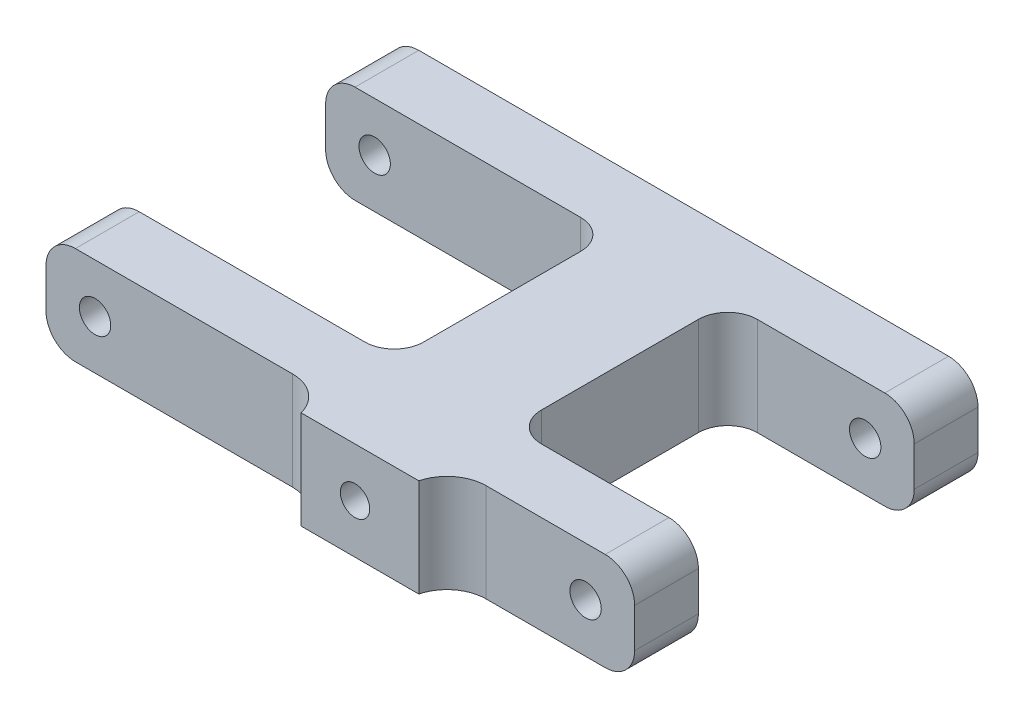
from build123d import *

# Parameters (mm, degrees)
SKETCH1_W               = 60
SKETCH1_H               = 35
BOSS_EXTRUDE1_DEPTH     = 10
SKETCH2_W               = 22
SKETCH2_H               = 10
CUT_EXTRUDE1_DEPTH      = 19
SKETCH3_W               = 22
SKETCH3_H               = 10
CUT_EXTRUDE2_DEPTH      = 29
SKETCH5_R               = 1.6
CUT_EXTRUDE4_DEPTH      = 71.178344238
FILLET1_R               = 3
FILLET2_R               = 3
SKETCH7_W               = 12
SKETCH7_H               = 10
BOSS_EXTRUDE2_DEPTH     = 3
CUT_EXTRUDE5_DEPTH      = 3
CUT_EXTRUDE5_DEPTH_BACK = 15
SKETCH6_R               = 1.5
FILLET3_R               = 4


with BuildPart() as part:
    # Sketch1 → Boss-Extrude1 (new body)
    with BuildSketch(Plane(origin=(0, 0, 0), x_dir=(1, 0, 0), z_dir=(0, 1, 0))):
        with Locations((30, -17.5)):
            Rectangle(SKETCH1_W, SKETCH1_H)
    extrude(amount=BOSS_EXTRUDE1_DEPTH)

    # Sketch2 → Cut-Extrude1 (cut)
    with BuildSketch(Plane(origin=(60, 0, 0), x_dir=(0, 0, -1), z_dir=(1, 0, 0))):
        with Locations((-17.5, 5)):
            Rectangle(SKETCH2_W, SKETCH2_H)
    extrude(amount=-CUT_EXTRUDE1_DEPTH, mode=Mode.SUBTRACT)

    # Sketch3 → Cut-Extrude2 (cut)
    with BuildSketch(Plane.ZY):
        with Locations((17.5, 5)):
            Rectangle(SKETCH3_W, SKETCH3_H)
    extrude(amount=-CUT_EXTRUDE2_DEPTH, mode=Mode.SUBTRACT)

    # Sketch5 → Cut-Extrude4 (cut, through all)
    with BuildSketch(Plane.XY.offset(35)):
        with Locations((5, 5)):
            Circle(SKETCH5_R)
        with Locations((55, 5)):
            Circle(SKETCH5_R)
    extrude(amount=-CUT_EXTRUDE4_DEPTH, mode=Mode.SUBTRACT)

    # Fillet1
    fillet1_edges = [part.edges().sort_by_distance(p)[0] for p in [
        (60, 10, 31.75),
        (60, 0, 3.25),
        (60, 10, 3.25),
        (0, 0, 31.75),
        (0, 10, 31.75),
        (0, 10, 3.25),
        (60, 0, 31.75),
        (0, 0, 3.25),
    ]]
    fillet(fillet1_edges, radius=FILLET1_R)

    # Fillet2
    fillet2_edges = [part.edges().sort_by_distance(p)[0] for p in [
        (41, 5, 28.5),
        (41, 5, 6.5),
        (29, 5, 6.5),
        (29, 5, 28.5),
    ]]
    fillet(fillet2_edges, radius=FILLET2_R)

    # Sketch7 → Boss-Extrude2 (add)
    with BuildSketch(Plane.XY.offset(35)):
        with Locations((35, 5)):
            Rectangle(SKETCH7_W, SKETCH7_H)
    extrude(amount=BOSS_EXTRUDE2_DEPTH)

    # Sketch6 → Cut-Extrude5 (cut, two sides: drawn at the far end of the back side and taken through both)
    with BuildSketch(Plane.XY.offset(35).offset(-CUT_EXTRUDE5_DEPTH_BACK)):
        with Locations((34.5, 5)):
            Circle(SKETCH6_R)
    extrude(amount=CUT_EXTRUDE5_DEPTH + CUT_EXTRUDE5_DEPTH_BACK, mode=Mode.SUBTRACT)

    # Fillet3
    # the kernel refuses this fillet: 4 mm, written as the material it adds along each edge
    with BuildSketch(Plane(origin=(41, 10, 35), x_dir=(0, 0, 1), z_dir=(0, -1, 0))) as fillet3_piece_1:
        with BuildLine():
            CenterArc((4, -3.872983346), FILLET3_R, 104.477512186, 75.522487814)
            Line((0, -3.872983346), (-0.08, -3.872983346))
            Line((-0.08, -3.872983346), (-0.08, 0))
            Line((-0.08, 0), (0, 0.08))
            ThreePointArc((0, 0.08), (1.5, 0.08), (2.98, 0.077459667))
            Line((2.98, 0.077459667), (3, 0))
        make_face()
    extrude(amount=10)
    with BuildSketch(Plane(origin=(29, 0, 35), x_dir=(-1, 0, 0), z_dir=(0, 1, 0))) as fillet3_piece_2:
        with BuildLine():
            CenterArc((3.872983346, 4), FILLET3_R, 194.477512186, 75.522487814)
            Line((0, 3), (-0.077459667, 2.98))
            ThreePointArc((-0.077459667, 2.98), (-0.08, 1.5), (-0.08, 0))
            Line((-0.08, 0), (0, -0.08))
            Line((0, -0.08), (3.872983346, -0.08))
            Line((3.872983346, -0.08), (3.872983346, 0))
        make_face()
    extrude(amount=10)


solid = part.part
